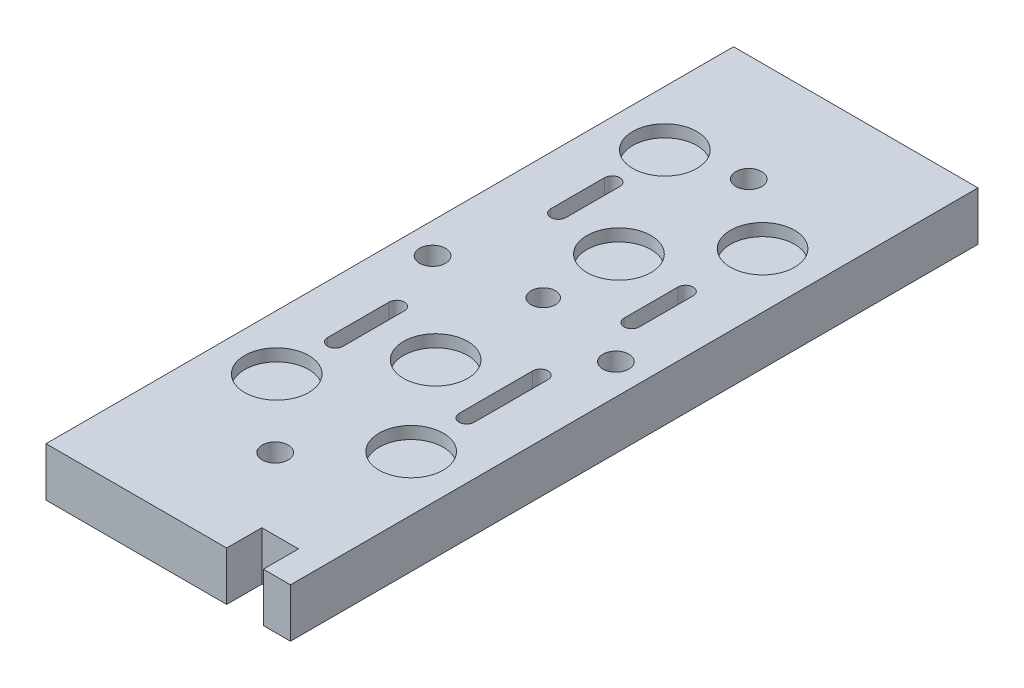
from build123d import *

# Parameters (mm, degrees)
SKETCH1_W           = 80
SKETCH1_H           = 225
BOSS_EXTRUDE1_DEPTH = 16
CUT_EXTRUDE1_REACH  = 122.467
SKETCH4_R           = 10.5
CUT_EXTRUDE2_DEPTH  = 4
SKETCH5_R           = 8.5
CUT_EXTRUDE3_DEPTH  = 5
CUT_EXTRUDE4_REACH  = 122.467
SKETCH6_W           = 12
SKETCH6_H           = 11.5
M10_TAPPED_HOLE1_D  = 8.5
CUT_EXTRUDE5_REACH  = 122.467
SKETCH10_R          = 4


with BuildPart() as part:
    # Sketch1 → Boss-Extrude1 (new body)
    with BuildSketch(Plane(origin=(0, 0, 0), x_dir=(1, 0, 0), z_dir=(0, 1, 0))):
        Rectangle(SKETCH1_W, SKETCH1_H)
    extrude(amount=-BOSS_EXTRUDE1_DEPTH)

    # Sketch2 → Cut-Extrude1 (cut, up to next)
    with BuildSketch(Plane(origin=(0, 0, 0), x_dir=(1, 0, 0), z_dir=(0, 1, 0)), mode=Mode.PRIVATE) as cut_extrude1_sk1:
        with BuildLine():
            Line((24, 17.68), (24, 35.28))
            ThreePointArc((24, 35.28), (21.5, 37.78), (19, 35.28))
            Line((19, 35.28), (19, 17.68))
            ThreePointArc((19, 17.68), (21.5, 15.18), (24, 17.68))
        make_face()
    cut_extrude1_tool1 = extrude(cut_extrude1_sk1.sketch, amount=-CUT_EXTRUDE1_REACH, mode=Mode.PRIVATE) & part.part
    # Sketch2 → Cut-Extrude1 (cut, up to next)
    with BuildSketch(Plane(origin=(0, 0, 0), x_dir=(1, 0, 0), z_dir=(0, 1, 0)), mode=Mode.PRIVATE) as cut_extrude1_sk2:
        with BuildLine():
            Line((24, -36.32), (24, -12.22))
            ThreePointArc((24, -12.22), (21.5, -9.72), (19, -12.22))
            Line((19, -12.22), (19, -36.32))
            ThreePointArc((19, -36.32), (21.5, -38.82), (24, -36.32))
        make_face()
    cut_extrude1_tool2 = extrude(cut_extrude1_sk2.sketch, amount=-CUT_EXTRUDE1_REACH, mode=Mode.PRIVATE) & part.part
    # Sketch2 → Cut-Extrude1 (cut, up to next)
    with BuildSketch(Plane(origin=(0, 0, 0), x_dir=(1, 0, 0), z_dir=(0, 1, 0)), mode=Mode.PRIVATE) as cut_extrude1_sk3:
        with BuildLine():
            Line((-24, -16.22), (-24, -36.32))
            ThreePointArc((-24, -36.32), (-21.5, -38.82), (-19, -36.32))
            Line((-19, -36.32), (-19, -16.22))
            ThreePointArc((-19, -16.22), (-21.5, -13.72), (-24, -16.22))
        make_face()
    cut_extrude1_tool3 = extrude(cut_extrude1_sk3.sketch, amount=-CUT_EXTRUDE1_REACH, mode=Mode.PRIVATE) & part.part
    # Sketch2 → Cut-Extrude1 (cut, up to next)
    with BuildSketch(Plane(origin=(0, 0, 0), x_dir=(1, 0, 0), z_dir=(0, 1, 0)), mode=Mode.PRIVATE) as cut_extrude1_sk4:
        with BuildLine():
            Line((-24, 54.28), (-24, 36.68))
            ThreePointArc((-24, 36.68), (-21.5, 34.18), (-19, 36.68))
            Line((-19, 36.68), (-19, 54.28))
            ThreePointArc((-19, 54.28), (-21.5, 56.78), (-24, 54.28))
        make_face()
    cut_extrude1_tool4 = extrude(cut_extrude1_sk4.sketch, amount=-CUT_EXTRUDE1_REACH, mode=Mode.PRIVATE) & part.part
    add(cut_extrude1_tool1.solids().sort_by_distance((21.5, 0, -26.48))[0], mode=Mode.SUBTRACT)
    add(cut_extrude1_tool2.solids().sort_by_distance((21.5, 0, 24.27))[0], mode=Mode.SUBTRACT)
    add(cut_extrude1_tool3.solids().sort_by_distance((-21.5, 0, 26.27))[0], mode=Mode.SUBTRACT)
    add(cut_extrude1_tool4.solids().sort_by_distance((-21.5, 0, -45.48))[0], mode=Mode.SUBTRACT)

    # Sketch4 → Cut-Extrude2 (cut)
    with BuildSketch(Plane(origin=(0, 0, 0), x_dir=(1, 0, 0), z_dir=(0, 1, 0))):
        with Locations((-22, 72)):
            Circle(SKETCH4_R)
        with Locations((22, 60)):
            Circle(SKETCH4_R)
        with Locations((0, 35)):
            Circle(SKETCH4_R)
        with Locations((0, -25)):
            Circle(SKETCH4_R)
        with Locations((22, -55)):
            Circle(SKETCH4_R)
        with Locations((-22, -55)):
            Circle(SKETCH4_R)
    extrude(amount=-CUT_EXTRUDE2_DEPTH, mode=Mode.SUBTRACT)

    # Sketch5 → Cut-Extrude3 (cut)
    with BuildSketch(Plane.XZ.offset(16)):
        with Locations((0, 100)):
            Circle(SKETCH5_R)
        with Locations((0, -100)):
            Circle(SKETCH5_R)
    extrude(amount=-CUT_EXTRUDE3_DEPTH, mode=Mode.SUBTRACT)

    # Sketch6 → Cut-Extrude4 (cut, up to next)
    with BuildSketch(Plane(origin=(0, 0, 0), x_dir=(1, 0, 0), z_dir=(0, 1, 0)), mode=Mode.PRIVATE) as cut_extrude4_sk1:
        with Locations((25.13, -106.75)):
            Rectangle(SKETCH6_W, SKETCH6_H)
    cut_extrude4_tool1 = extrude(cut_extrude4_sk1.sketch, amount=-CUT_EXTRUDE4_REACH, mode=Mode.PRIVATE) & part.part
    add(cut_extrude4_tool1.solids().sort_by_distance((25.13, 0, 106.75))[0], mode=Mode.SUBTRACT)

    # M10 Tapped Hole1 (through all)
    with Locations(Plane(origin=(0, 0, 0), x_dir=(1, 0, 0), z_dir=(0, 1, 0))):
        with Locations((0, -77.5), (30, 4), (-30, 4), (0, 77.5)):
            Hole(M10_TAPPED_HOLE1_D / 2)

    # Sketch10 → Cut-Extrude5 (cut, up to next)
    with BuildSketch(Plane(origin=(0, 0, 0), x_dir=(1, 0, 0), z_dir=(0, 1, 0)), mode=Mode.PRIVATE) as cut_extrude5_sk1:
        with Locations((0, 10.23)):
            Circle(SKETCH10_R)
    cut_extrude5_tool1 = extrude(cut_extrude5_sk1.sketch, amount=-CUT_EXTRUDE5_REACH, mode=Mode.PRIVATE) & part.part
    add(cut_extrude5_tool1.solids().sort_by_distance((0, 0, -10.23))[0], mode=Mode.SUBTRACT)


solid = part.part
